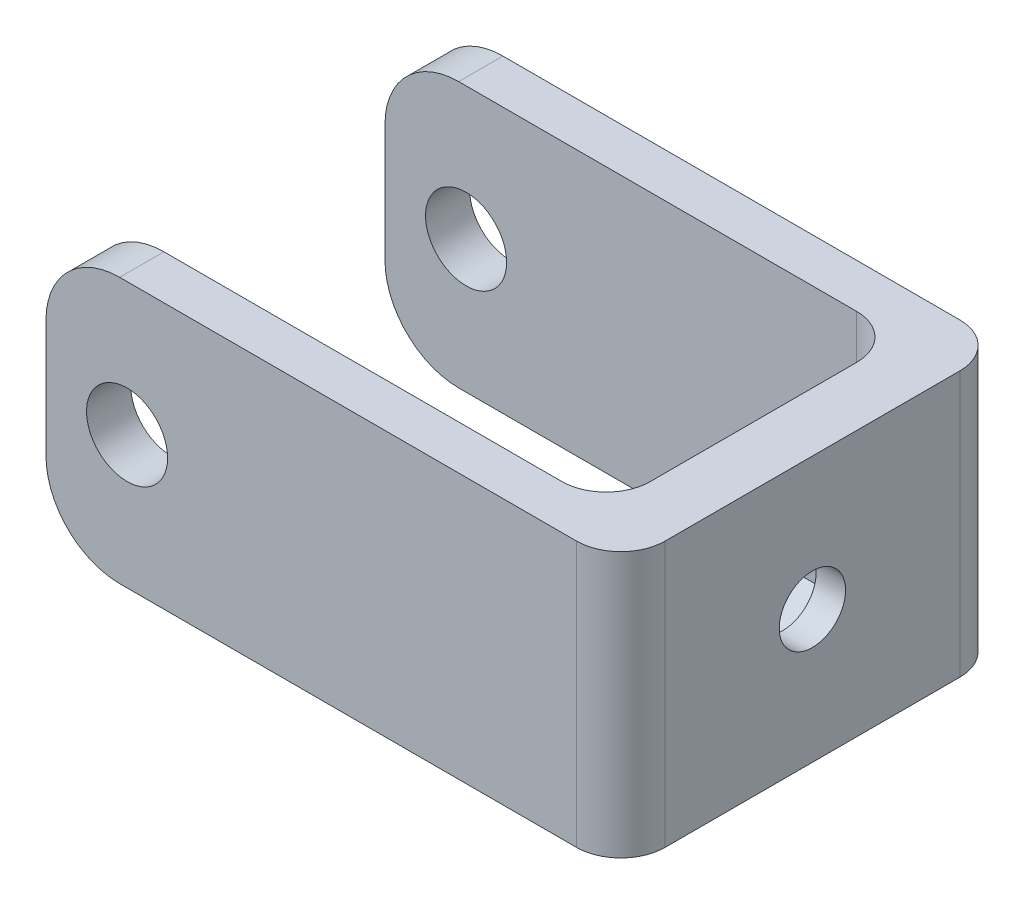
from build123d import *

# Parameters (mm, degrees)
SKETCH1_W           = 26
SKETCH1_H           = 18
BOSS_EXTRUDE1_DEPTH = 4
SKETCH2_W           = 3
SKETCH2_H           = 18
BOSS_EXTRUDE2_DEPTH = 35
SKETCH3_R           = 2.75
CUT_EXTRUDE1_DEPTH  = 45.519658579
FILLET1_R           = 3
FILLET2_R           = 5
SKETCH5_R           = 7
BOSS_EXTRUDE3_DEPTH = 2
CUT_EXTRUDE3_REACH  = 44.083
SKETCH7_R           = 2.25
CUT_EXTRUDE4_DEPTH  = 4
CHAMFER1_SIZE       = 2


with BuildPart() as part:
    # Sketch1 → Boss-Extrude1 (new body)
    with BuildSketch(Plane(origin=(0, 0, 0), x_dir=(0, 0, -1), z_dir=(1, 0, 0))):
        Rectangle(SKETCH1_W, SKETCH1_H)
    extrude(amount=BOSS_EXTRUDE1_DEPTH)

    # Sketch2 → Boss-Extrude2 (add)
    with BuildSketch(Plane.ZY):
        with Locations((-11.5, 0)):
            Rectangle(SKETCH2_W, SKETCH2_H)
        with Locations((11.5, 0)):
            Rectangle(SKETCH2_W, SKETCH2_H)
    extrude(amount=BOSS_EXTRUDE2_DEPTH)

    # Sketch3 → Cut-Extrude1 (cut, through all)
    with BuildSketch(Plane.XY.offset(13)):
        with Locations((-29.5, 0)):
            Circle(SKETCH3_R)
    extrude(amount=-CUT_EXTRUDE1_DEPTH, mode=Mode.SUBTRACT)

    # Fillet1
    fillet1_edges = [part.edges().sort_by_distance(p)[0] for p in [
        (4, 0, 13),
        (0, 0, -10),
        (0, 0, 10),
        (4, 0, -13),
    ]]
    fillet(fillet1_edges, radius=FILLET1_R)

    # Fillet2
    fillet2_edges = [part.edges().sort_by_distance(p)[0] for p in [
        (-35, -9, -11.5),
        (-35, 9, -11.5),
        (-35, 9, 11.5),
        (-35, -9, 11.5),
    ]]
    fillet(fillet2_edges, radius=FILLET2_R)

    # Sketch5 → Boss-Extrude3 (add)
    with BuildSketch(Plane.ZY):
        Circle(SKETCH5_R)
    extrude(amount=BOSS_EXTRUDE3_DEPTH)

    # Sketch7 → Cut-Extrude3 (cut, up to next)
    with BuildSketch(Plane(origin=(4, 0, 0), x_dir=(0, 0, -1), z_dir=(1, 0, 0)), mode=Mode.PRIVATE) as cut_extrude3_sk1:
        Circle(SKETCH7_R)
    cut_extrude3_tool1 = extrude(cut_extrude3_sk1.sketch, amount=-CUT_EXTRUDE3_REACH, mode=Mode.PRIVATE) & part.part
    add(cut_extrude3_tool1.solids().sort_by_distance((4, 0, 0))[0], mode=Mode.SUBTRACT)

    # Sketch8 → Cut-Extrude4 (cut)
    with BuildSketch(Plane.ZY.offset(2)):
        Polygon((0, 4.330127019), (-3.75, 2.165063509), (-3.75, -2.165063509), (0, -4.330127019), (3.75, -2.165063509), (3.75, 2.165063509), align=None)
    extrude(amount=-CUT_EXTRUDE4_DEPTH, mode=Mode.SUBTRACT)

    # Chamfer1
    # the kernel refuses this chamfer: 2 mm, written as the material it adds along each edge
    with BuildSketch(Plane(origin=(0, 0, 0), x_dir=(0, 0, 1), z_dir=(0, -1, 0))) as chamfer1_piece_1_section:
        Polygon((7 + CHAMFER1_SIZE, 0), (7, CHAMFER1_SIZE), (7, 0), align=None)
    chamfer1_piece_1 = revolve(axis=Axis((0, 0, 0), (-1, 0, 0)), revolution_arc=180.000000041, mode=Mode.PRIVATE)
    chamfer1_piece_1 = split(chamfer1_piece_1, bisect_by=Plane(origin=(-0.945175713, 9, -3e-09), z_dir=(0, -1, 0)), keep=Keep.TOP, mode=Mode.PRIVATE)
    chamfer1_piece_1 = split(chamfer1_piece_1, bisect_by=Plane(origin=(-2, 8.001744255, -3e-09), z_dir=(1, 0, 0)), keep=Keep.TOP, mode=Mode.PRIVATE)
    add(chamfer1_piece_1)
    with BuildSketch(Plane(origin=(0, 0, 0), x_dir=(0, -7.23525117256177e-10, -1.0), z_dir=(0, 1.0, -7.23525117256177e-10))) as chamfer1_piece_2_section:
        Polygon((7 + CHAMFER1_SIZE, 0), (7, CHAMFER1_SIZE), (7, 0), align=None)
    chamfer1_piece_2 = revolve(axis=Axis((0, 0, 0), (-1, 0, 0)), revolution_arc=179.999999959, mode=Mode.PRIVATE)
    chamfer1_piece_2 = split(chamfer1_piece_2, bisect_by=Plane(origin=(-0.945175715, -9, 3e-09), z_dir=(0, 1, 0)), keep=Keep.TOP, mode=Mode.PRIVATE)
    chamfer1_piece_2 = split(chamfer1_piece_2, bisect_by=Plane(origin=(-2, -8.001744258, 3e-09), z_dir=(1, 0, 0)), keep=Keep.TOP, mode=Mode.PRIVATE)
    add(chamfer1_piece_2)


solid = part.part
